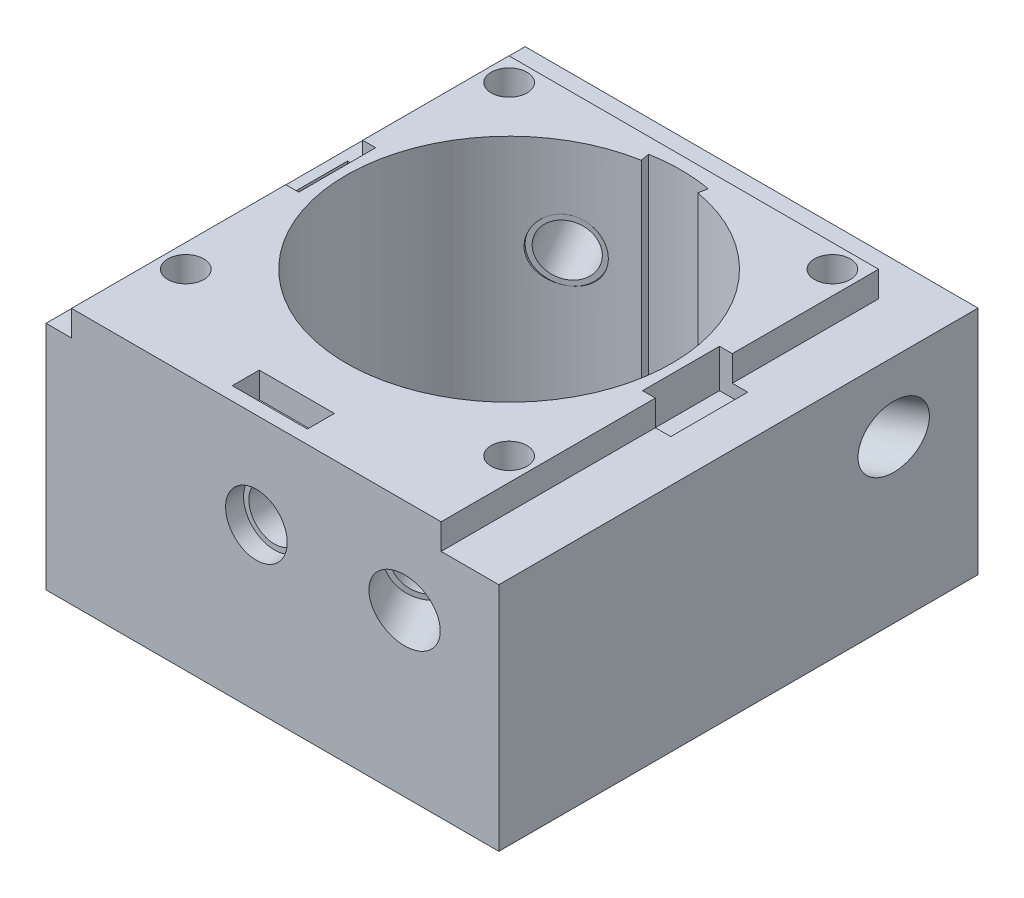
from build123d import *

# Parameters (mm, degrees)
SKETCH1_W                 = 41.656
SKETCH1_H                 = 45.847
BOSS_EXTRUDE1_DEPTH       = 25.4
SKETCH2_R                 = 16.129
CUT_EXTRUDE1_DEPTH        = 25.4
SKETCH3_W                 = 2.794
SKETCH3_H                 = 7.62
CUT_EXTRUDE2_DEPTH        = 3.81
CUT_EXTRUDE6_START        = -25.4
CUT_EXTRUDE6_DEPTH        = 25.4
CUT_EXTRUDE7_REACH        = 58.4
CUT_EXTRUDE7_END_RADIUS   = 16.129
SKETCH7_R                 = 3.048
SKETCH14_W                = 7.43654476
SKETCH14_H                = 2.672753785
SKETCH14_W_2              = 2.524584731
SKETCH14_H_2              = 43.307
CUT_EXTRUDE10_DEPTH       = 2.54
SKETCH17_W                = 45.847
SKETCH17_H                = 22.86
BOSS_EXTRUDE3_DEPTH       = 3.175
CUT_EXTRUDE12_REACH       = 43.576
SKETCH12_R                = 3.048
SKETCH18_W                = 44.831
SKETCH18_H                = 22.86
BOSS_EXTRUDE4_DEPTH       = 1.5875
CUT_EXTRUDE13_DEPTH       = 44.190833792
CUT_EXTRUDE13_DEPTH_BACK  = 44.190833792
SKETCH11_R                = 3.048
SKETCH4_R                 = 1.778
CUT_EXTRUDE14_DEPTH       = 43.685983001
SKETCH19_R                = 3.175
SKETCH19_R_2              = 2.54
BOSS_EXTRUDE5_DEPTH       = 7.112
CIRPATTERN3_START         = 14.321246389
CIRPATTERN3_OUTLINE_R     = 3.048
CIRPATTERN3_OUTLINE_R_2   = 2.54
CIRPATTERN3_DEPTH         = 7.112
CIRPATTERN3_START_2       = 17.188786362
CIRPATTERN3_2_OUTLINE_R   = 3.048
CIRPATTERN3_2_OUTLINE_R_2 = 2.54
CIRPATTERN3_2_DEPTH       = 7.112
CIRPATTERN3_START_3       = 14.033500302
CIRPATTERN3_3_OUTLINE_W   = 10
CIRPATTERN3_3_OUTLINE_H   = 10
CIRPATTERN3_3_OUTLINE_R   = 2.54
CIRPATTERN3_3_DEPTH       = 7.112


# Read off the part's stored shape, not the designer's step: CirPattern3
with BuildPart() as part:
    # Sketch1 → Boss-Extrude1 (new body)
    with BuildSketch(Plane(origin=(0, 0, 0), x_dir=(1, 0, 0), z_dir=(0, 1, 0))):
        Rectangle(SKETCH1_W, SKETCH1_H)
    extrude(amount=BOSS_EXTRUDE1_DEPTH)

    # Sketch2 → Cut-Extrude1 (cut)
    with BuildSketch(Plane(origin=(0, 25.4, 0), x_dir=(1, 0, 0), z_dir=(0, 1, 0))):
        with Locations(Location((0, 2.0955, 0), (0, 0, 270))):
            Circle(SKETCH2_R)
    extrude(amount=-CUT_EXTRUDE1_DEPTH, mode=Mode.SUBTRACT)

    # Sketch3 → Cut-Extrude2 (cut)
    with BuildSketch(Plane(origin=(0, 25.4, 0), x_dir=(1, 0, 0), z_dir=(0, 1, 0))):
        with Locations((18.415, 2.0955)):
            Rectangle(SKETCH3_W, SKETCH3_H)
        with Locations((-18.415, 2.0955)):
            Rectangle(SKETCH3_W, SKETCH3_H)
    extrude(amount=-CUT_EXTRUDE2_DEPTH, mode=Mode.SUBTRACT)

    # Sketch6 → Cut-Extrude6 (cut)
    with BuildSketch(Plane(origin=(0, 25.4, 0), x_dir=(1, 0, 0), z_dir=(0, 1, 0)).offset(CUT_EXTRUDE6_START)):
        with BuildLine():
            ThreePointArc((-2.800771458, 17.979464248), (-1.405734975, 18.163124286), (0, 18.2245))
            ThreePointArc((0, 18.2245), (1.405734975, 18.163124286), (2.800771458, 17.979464248))
            Line((2.800771458, 17.979464248), (2.955144688, 18.854958341))
            ThreePointArc((2.955144688, 18.854958341), (0, 19.1135), (-2.955144688, 18.854958341))
            Line((-2.955144688, 18.854958341), (-2.800771458, 17.979464248))
        make_face()
        with BuildLine():
            Line((0, 18.2245), (0, 2.0955))
            Line((0, 2.0955), (2.800771458, 17.979464248))
            ThreePointArc((2.800771458, 17.979464248), (1.405734975, 18.163124286), (0, 18.2245))
        make_face()
        with BuildLine():
            Line((-2.800771458, 17.979464248), (0, 2.0955))
            Line((0, 2.0955), (0, 18.2245))
            ThreePointArc((0, 18.2245), (-1.405734975, 18.163124286), (-2.800771458, 17.979464248))
        make_face()
    extrude(amount=CUT_EXTRUDE6_DEPTH, mode=Mode.SUBTRACT)

    # Cut-Extrude7: up to this cylinder (the profile starts outside it)
    cut_extrude7_end = Plane(origin=(0, 16.002, -2.0955), z_dir=(0, 1, 0)) * Cylinder(CUT_EXTRUDE7_END_RADIUS, 150.058, mode=Mode.PRIVATE)
    # Sketch7 → Cut-Extrude7 (cut, up to the surface)
    with BuildSketch(Plane.XY.offset(22.9235), mode=Mode.PRIVATE) as cut_extrude7_sk1:
        with Locations((0, 16.002)):
            Circle(SKETCH7_R)
    cut_extrude7_tool1 = extrude(cut_extrude7_sk1.sketch, amount=-CUT_EXTRUDE7_REACH, mode=Mode.PRIVATE) - cut_extrude7_end
    add(cut_extrude7_tool1.solids().sort_by_distance((0, 16.002, 22.9235))[0], mode=Mode.SUBTRACT)

    # Sketch14 → Cut-Extrude10 (cut)
    with BuildSketch(Plane(origin=(0, 25.4, 0), x_dir=(1, 0, 0), z_dir=(0, 1, 0))):
        with Locations((0, -20.25731759)):
            Rectangle(SKETCH14_W, SKETCH14_H)
        Polygon((20.828, -22.9235), (20.828, 20.3835), (18.288, 20.3835), (18.288, 5.9055), (19.812, 5.9055), (19.812, -1.7145), (18.288, -1.7145), (18.288, -22.9235), align=None)
        Polygon((20.828, 22.9235), (-20.828, 22.9235), (-20.828, 20.3835), (-18.303415269, 20.3835), (18.288, 20.3835), (20.828, 20.3835), align=None)
        with Locations((-19.565707635, -1.27)):
            Rectangle(SKETCH14_W_2, SKETCH14_H_2)
    extrude(amount=-CUT_EXTRUDE10_DEPTH, mode=Mode.SUBTRACT)

    # Sketch17 → Boss-Extrude3 (add)
    with BuildSketch(Plane(origin=(20.828, 0, 0), x_dir=(0, 0, -1), z_dir=(1, 0, 0))):
        with Locations((0, 11.43)):
            Rectangle(SKETCH17_W, SKETCH17_H)
    extrude(amount=BOSS_EXTRUDE3_DEPTH)

    # Cut-Extrude12: up to this plane
    cut_extrude12_end = Plane(origin=(24.003, 0, 0), z_dir=(1, 0, 0))
    # Sketch12 → Cut-Extrude12 (cut, up to the surface)
    with BuildSketch(Plane(origin=(0.914260378, 0, -0.535980498), x_dir=(-0.50574390925612, 0, -0.862683660590797), z_dir=(0.862683660590797, 0, -0.50574390925612)), mode=Mode.PRIVATE) as cut_extrude12_sk1:
        with Locations(Location((1.807753611, 16.002, 0), (0, 0, 180))):
            Circle(SKETCH12_R)
    cut_extrude12_tool1 = split(extrude(cut_extrude12_sk1.sketch, amount=CUT_EXTRUDE12_REACH, mode=Mode.PRIVATE), bisect_by=cut_extrude12_end, keep=Keep.BOTH, mode=Mode.PRIVATE)
    add(cut_extrude12_tool1.solids().sort_by_distance((0, 16.002, -2.0955))[0], mode=Mode.SUBTRACT)

    # Sketch18 → Boss-Extrude4 (add)
    with BuildSketch(Plane(origin=(0, 0, -22.9235), x_dir=(-1, 0, 0), z_dir=(0, 0, -1))):
        with Locations((-1.5875, 11.43)):
            Rectangle(SKETCH18_W, SKETCH18_H)
    extrude(amount=BOSS_EXTRUDE4_DEPTH)

    # Sketch11 → Cut-Extrude13 (cut, two sides: drawn at the far end of the back side and taken through both)
    with BuildSketch(Plane(origin=(-0.914260378, 0, -1.559519502), x_dir=(0.862683660590797, 0, -0.50574390925612), z_dir=(0.50574390925612, 0, 0.862683660590797)).offset(-CUT_EXTRUDE13_DEPTH_BACK)):
        with Locations((1.059786362, 16.002)):
            Circle(SKETCH11_R)
    extrude(amount=CUT_EXTRUDE13_DEPTH + CUT_EXTRUDE13_DEPTH_BACK, mode=Mode.SUBTRACT)

    # Sketch4 → Cut-Extrude14 (cut, through all)
    with BuildSketch(Plane(origin=(0, 25.4, 0), x_dir=(1, 0, 0), z_dir=(0, 1, 0))):
        with Locations(Location((-16.002, -13.9065, 0), (0, 0, 270))):
            Circle(SKETCH4_R)
        with Locations(Location((-16.002, 18.0975, 0), (0, 0, 90))):
            Circle(SKETCH4_R)
        with Locations(Location((16.002, 18.0975, 0), (0, 0, 270))):
            Circle(SKETCH4_R)
        with Locations(Location((16.002, -13.9065, 0), (0, 0, 90))):
            Circle(SKETCH4_R)
    extrude(amount=-CUT_EXTRUDE14_DEPTH, mode=Mode.SUBTRACT)

    # Sketch19 → Boss-Extrude5 (add)
    with BuildSketch(Plane(origin=(-9.07140389, 0, -15.473744264), x_dir=(0.8626836605907969, 0, -0.5057439092561202), z_dir=(0.5057439092561202, 0, 0.8626836605907969))):
        with Locations((1.059786362, 16.002)):
            Circle(SKETCH19_R)
        with Locations((1.059786362, 16.002)):
            Circle(SKETCH19_R_2, mode=Mode.SUBTRACT)
    extrude(amount=-BOSS_EXTRUDE5_DEPTH)

    # CirPattern3 outline → CirPattern3 (add)
    with BuildSketch(Plane(origin=(0, 0, 0), x_dir=(0.8626836605907969, 0, -0.5057439092561199), z_dir=(0.50574390925612, 0, 0.862683660590797)).offset(CIRPATTERN3_START)):
        with Locations((1.059786362, 16.002)):
            Circle(CIRPATTERN3_OUTLINE_R)
        with Locations((1.059786362, 16.002)):
            Circle(CIRPATTERN3_OUTLINE_R_2, mode=Mode.SUBTRACT)
    extrude(amount=CIRPATTERN3_DEPTH)

    # CirPattern3 2 outline → CirPattern3 2 (add)
    with BuildSketch(Plane(origin=(0, 0, 0), x_dir=(0.5057439092561169, 0, 0.8626836605907988), z_dir=(0.8626836605907988, 0, -0.5057439092561169)).offset(CIRPATTERN3_START_2)):
        with Locations((-1.807753611, -16.002)):
            Circle(CIRPATTERN3_2_OUTLINE_R)
        with Locations((-1.807753611, -16.002)):
            Circle(CIRPATTERN3_2_OUTLINE_R_2, mode=Mode.SUBTRACT)
    extrude(amount=CIRPATTERN3_2_DEPTH)

    # CirPattern3 3 outline → CirPattern3 3 (add)
    with BuildSketch(Plane(origin=(0, 0, 0), x_dir=(0.9999998560090501, 0, -0.0005366394310553081), z_dir=(0.0005366394310553081, 0, 0.9999998560090502)).offset(CIRPATTERN3_START_3)):
        with Locations((0, 16)):
            Rectangle(CIRPATTERN3_3_OUTLINE_W, CIRPATTERN3_3_OUTLINE_H)
        with Locations((0.001124528, 16.002)):
            Circle(CIRPATTERN3_3_OUTLINE_R, mode=Mode.SUBTRACT)
    extrude(amount=CIRPATTERN3_3_DEPTH)


solid = part.part
